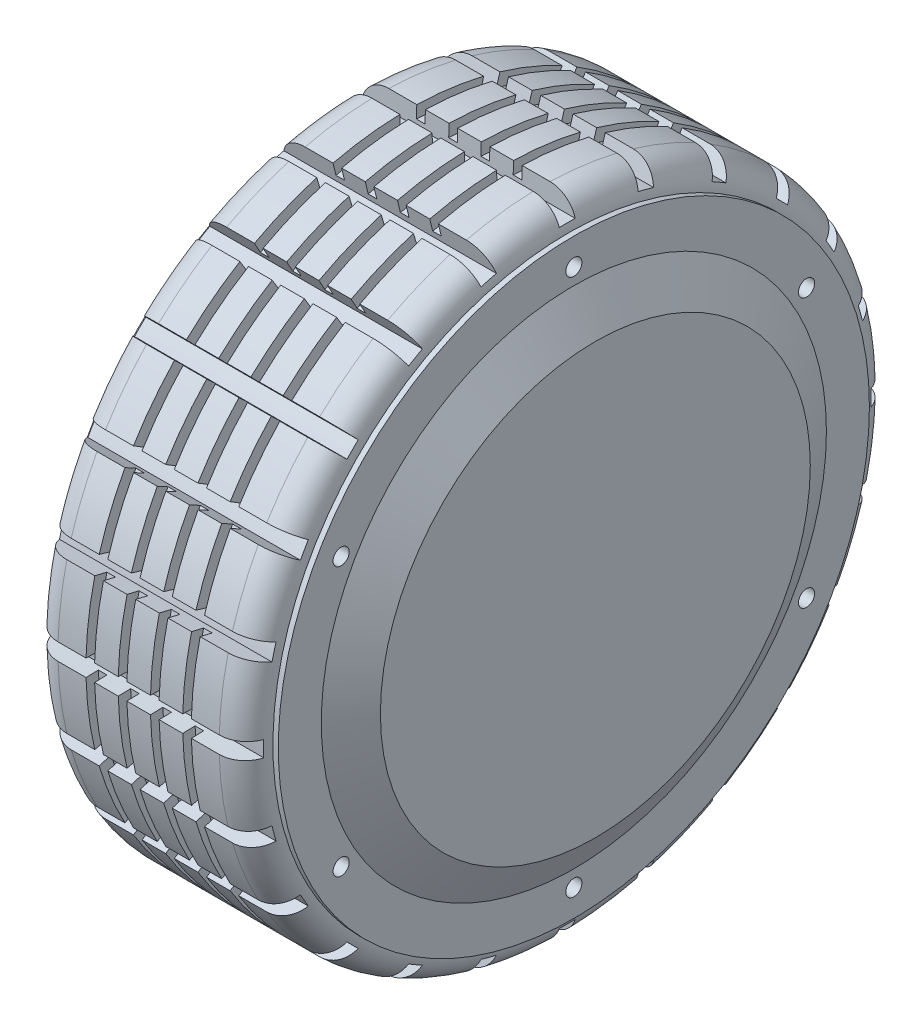
from build123d import *

# Parameters (mm, degrees)
SKETCH_2_W               = 40
SKETCH_2_H               = 60
CUT_EXTRUDE_2_DEPTH      = 1
CUT_EXTRUDE_2_DEPTH_BACK = 1
SKETCH_4_R               = 5
FILLET_1_R               = 5
FILLET_2_R               = 5
SKETCH_9_R               = 1.5
CUT_EXTRUDE_4_DEPTH      = 5
PATTERN_CIRCULAR_1_COUNT = 6
MIRROR_2_COPY_1_SKETCH_R = 1.5
MIRROR_2_COPY_1_DEPTH    = 5
MIRROR_2_COPY_2_SKETCH_R = 1.5
MIRROR_2_COPY_2_DEPTH    = 5
MIRROR_2_COPY_3_SKETCH_R = 1.5
MIRROR_2_COPY_3_DEPTH    = 5
MIRROR_2_COPY_4_SKETCH_R = 1.5
MIRROR_2_COPY_4_DEPTH    = 5
MIRROR_2_COPY_5_SKETCH_R = 1.5
MIRROR_2_COPY_5_DEPTH    = 5
CUT_EXTRUDE_START        = -25
SKETCH_14_R              = 5
CUT_EXTRUDE_7_DEPTH      = 25
PATTERN_LINEAR_1_COUNT   = 4
PATTERN_LINEAR_1_PITCH   = 6
CUT_EXTRUDE_8_REACH      = 119.541
PATTERN_START            = -19.769696007
PATTERN_CIRCULAR_2_DEPTH = 39.539392014


# Read off the part's stored shape, not the designer's step: 阵列(圆周)2
with BuildPart() as part:
    # 草图2 → 旋转1 (revolve)
    with BuildSketch(Plane.XY, mode=Mode.PRIVATE) as revolve_1_sk:
        Rectangle(SKETCH_2_W, SKETCH_2_H)
    revolve(revolve_1_sk.sketch.rotate(Axis((-20, -30, 0), (1, 0, 0)), 90), axis=Axis((-20, -30, 0), (1, 0, 0)))

    # 草图4 → 切除-拉伸2 (cut, two sides: drawn at the far end of the back side and taken through both)
    with BuildSketch(Plane(origin=(20, 0, 0), x_dir=(0, 0, -1), z_dir=(1, 0, 0)).offset(-CUT_EXTRUDE_2_DEPTH_BACK)):
        with Locations(Location((0, -30, 0), (0, 0, 180))):
            Circle(SKETCH_4_R)
    extrude(amount=CUT_EXTRUDE_2_DEPTH + CUT_EXTRUDE_2_DEPTH_BACK, mode=Mode.SUBTRACT)

    # 圆角1
    fillet_1_edges = [part.edges().sort_by_distance(p)[0] for p in [
        (20, -30, -60),
    ]]
    fillet(fillet_1_edges, radius=FILLET_1_R)

    # 圆角2
    fillet_2_edges = [part.edges().sort_by_distance(p)[0] for p in [
        (-20, -30, -60),
    ]]
    fillet(fillet_2_edges, radius=FILLET_2_R)

    # 草图7 → 旋转2 (revolve)
    with BuildSketch(Plane.XY, mode=Mode.PRIVATE) as revolve_2_sk:
        Polygon((-20, -30), (-25, -30), (-25, -70), (-21, -77), (-21, -85), (-20, -85), align=None)
    revolve_2 = revolve(revolve_2_sk.sketch.rotate(Axis((-20, -30, 0), (-1, 0, 0)), 270), axis=Axis((-20, -30, 0), (-1, 0, 0)))

    # 镜向1: 旋转2 across plane
    add(revolve_2.mirror(Plane(origin=(0, 0, 0), x_dir=(0, 0, 1), z_dir=(1, 0, 0))))

    # 草图9 → 切除-拉伸4 (cut)
    with BuildSketch(Plane.ZY.offset(21)):
        with Locations((0, 20)):
            Circle(SKETCH_9_R)
    cut_extrude_4 = extrude(amount=-CUT_EXTRUDE_4_DEPTH, mode=Mode.SUBTRACT)

    # 阵列(圆周)1: 切除-拉伸4 ×6 about axis
    pattern_circular_1_axis = Axis((0, -30, 0), (1, 0, 0))
    for i in range(1, PATTERN_CIRCULAR_1_COUNT):
        add(cut_extrude_4.rotate(pattern_circular_1_axis, i * 360 / PATTERN_CIRCULAR_1_COUNT), mode=Mode.SUBTRACT)

    # 镜向2: 切除-拉伸4 across plane
    add(cut_extrude_4.mirror(Plane(origin=(0, 0, 0), x_dir=(0, 0, 1), z_dir=(1, 0, 0))), mode=Mode.SUBTRACT)

    # 镜向2 copy 1 sketch → 镜向2 copy 1 (cut)
    with BuildSketch(Plane(origin=(21, -15, 25.980762114), x_dir=(0, -0.8660254037844386, 0.5000000000000001), z_dir=(1, 0, 0))):
        with Locations((0, -20)):
            Circle(MIRROR_2_COPY_1_SKETCH_R)
    extrude(amount=-MIRROR_2_COPY_1_DEPTH, mode=Mode.SUBTRACT)

    # 镜向2 copy 2 sketch → 镜向2 copy 2 (cut)
    with BuildSketch(Plane(origin=(21, -45, 25.980762114), x_dir=(0, -0.8660254037844387, -0.4999999999999998), z_dir=(1, 0, 0))):
        with Locations((0, -20)):
            Circle(MIRROR_2_COPY_2_SKETCH_R)
    extrude(amount=-MIRROR_2_COPY_2_DEPTH, mode=Mode.SUBTRACT)

    # 镜向2 copy 3 sketch → 镜向2 copy 3 (cut)
    with BuildSketch(Plane(origin=(21, -60, 0), x_dir=(0, 0, -1), z_dir=(1, 0, 0))):
        with Locations((0, -20)):
            Circle(MIRROR_2_COPY_3_SKETCH_R)
    extrude(amount=-MIRROR_2_COPY_3_DEPTH, mode=Mode.SUBTRACT)

    # 镜向2 copy 4 sketch → 镜向2 copy 4 (cut)
    with BuildSketch(Plane(origin=(21, -45, -25.980762114), x_dir=(0, 0.8660254037844384, -0.5000000000000004), z_dir=(1, 0, 0))):
        with Locations((0, -20)):
            Circle(MIRROR_2_COPY_4_SKETCH_R)
    extrude(amount=-MIRROR_2_COPY_4_DEPTH, mode=Mode.SUBTRACT)

    # 镜向2 copy 5 sketch → 镜向2 copy 5 (cut)
    with BuildSketch(Plane(origin=(21, -15, -25.980762114), x_dir=(0, 0.8660254037844386, 0.5000000000000001), z_dir=(1, 0, 0))):
        with Locations((0, -20)):
            Circle(MIRROR_2_COPY_5_SKETCH_R)
    extrude(amount=-MIRROR_2_COPY_5_DEPTH, mode=Mode.SUBTRACT)

    # 草图14 → 切除-拉伸7 (cut)
    with BuildSketch(Plane.ZY.offset(25).offset(CUT_EXTRUDE_START)):
        with Locations((0, -30)):
            Circle(SKETCH_14_R)
    extrude(amount=CUT_EXTRUDE_7_DEPTH, mode=Mode.SUBTRACT)

    # 草图16 → 切除-旋转1 (revolve, cut)
    with BuildSketch(Plane.XY, mode=Mode.PRIVATE) as cut_revolve_1_sk:
        Polygon((-9.8, 27.7), (-9.8, 30), (-9, 30), (-8.2, 30), (-8.2, 27.7), align=None)
    cut_revolve_1 = revolve(cut_revolve_1_sk.sketch.rotate(Axis((-25, -30, 0), (-1, 0, 0)), 90), axis=Axis((-25, -30, 0), (-1, 0, 0)), mode=Mode.SUBTRACT)

    # 阵列(线性)1: 切除-旋转1 ×4
    with Locations(*[(i * PATTERN_LINEAR_1_PITCH, 0, 0) for i in range(1, PATTERN_LINEAR_1_COUNT)]):
        add(cut_revolve_1, mode=Mode.SUBTRACT)

    # 草图17 → 切除-拉伸8 (cut, up to next)
    with BuildSketch(Plane.ZY.offset(21), mode=Mode.PRIVATE) as cut_extrude_8_sk1:
        with BuildLine():
            Line((1.478997579, 26.480638861), (1.570616898, 29.979439499))
            ThreePointArc((1.570616898, 29.979439499), (0, 30), (-1.570616898, 29.979439499))
            Line((-1.570616898, 29.979439499), (-1.478997579, 26.480638861))
            ThreePointArc((-1.478997579, 26.480638861), (0, 26.5), (1.478997579, 26.480638861))
        make_face()
    cut_extrude_8_tool1 = extrude(cut_extrude_8_sk1.sketch, amount=-CUT_EXTRUDE_8_REACH, mode=Mode.PRIVATE) & part.part
    add(cut_extrude_8_tool1.solids().sort_by_distance((-21, 28.260869, 0))[0], mode=Mode.SUBTRACT)

    # 阵列(圆周)2 outline → 阵列(圆周)2 (cut)
    with BuildSketch(Plane.YZ.offset(PATTERN_START)):
        with BuildLine():
            ThreePointArc((24.17331502, 16.046866976), (24.574809185, 14.623276048), (24.938900502, 13.189663058))
            Line((24.938900502, 13.189663058), (28.342195224, 14.006721831))
            ThreePointArc((28.342195224, 14.006721831), (27.955549578, 15.529142706), (27.529184093, 17.040920682))
            Line((27.529184093, 17.040920682), (24.17331502, 16.046866976))
        make_face()
        with BuildLine():
            Line((21.158409862, 31.349913883), (18.174169286, 29.521168906))
            ThreePointArc((18.174169286, 29.521168906), (18.930435314, 28.25), (19.653166865, 26.959469955))
            Line((19.653166865, 26.959469955), (22.72902676, 28.629525616))
            ThreePointArc((22.72902676, 28.629525616), (21.961524227, 30), (21.158409862, 31.349913883))
        make_face()
        with BuildLine():
            Line((11.301274542, 43.522462261), (8.892033527, 40.983651962))
            ThreePointArc((8.892033527, 40.983651962), (9.951533137, 39.951533137), (10.983651962, 38.892033527))
            Line((10.983651962, 38.892033527), (13.522462261, 41.301274542))
            ThreePointArc((13.522462261, 41.301274542), (12.426406871, 42.426406871), (11.301274542, 43.522462261))
        make_face()
        with BuildLine():
            Line((-1.370474384, 52.72902676), (-3.040530045, 49.653166865))
            ThreePointArc((-3.040530045, 49.653166865), (-1.75, 48.930435314), (-0.478831094, 48.174169286))
            Line((-0.478831094, 48.174169286), (1.349913883, 51.158409861))
            ThreePointArc((1.349913883, 51.158409861), (0, 51.961524227), (-1.370474384, 52.72902676))
        make_face()
        with BuildLine():
            Line((-15.993278169, 58.342195224), (-16.810336942, 54.938900502))
            ThreePointArc((-16.810336942, 54.938900502), (-15.376723952, 54.574809185), (-13.953133024, 54.17331502))
            Line((-13.953133024, 54.17331502), (-12.959079318, 57.529184092))
            ThreePointArc((-12.959079318, 57.529184092), (-14.470857294, 57.955549578), (-15.993278169, 58.342195224))
        make_face()
        with BuildLine():
            Line((-31.570616898, 59.979439499), (-31.478997579, 56.480638861))
            ThreePointArc((-31.478997579, 56.480638861), (-30, 56.5), (-28.521002421, 56.480638861))
            Line((-28.521002421, 56.480638861), (-28.429383102, 59.979439499))
            ThreePointArc((-28.429383102, 59.979439499), (-30, 60), (-31.570616898, 59.979439499))
        make_face()
        with BuildLine():
            Line((-47.040920682, 57.529184092), (-46.046866976, 54.17331502))
            ThreePointArc((-46.046866976, 54.17331502), (-44.623276048, 54.574809185), (-43.189663058, 54.938900502))
            Line((-43.189663058, 54.938900502), (-44.006721831, 58.342195224))
            ThreePointArc((-44.006721831, 58.342195224), (-45.529142706, 57.955549578), (-47.040920682, 57.529184092))
        make_face()
        with BuildLine():
            Line((-61.349913883, 51.158409861), (-59.521168906, 48.174169286))
            ThreePointArc((-59.521168906, 48.174169286), (-58.25, 48.930435314), (-56.959469955, 49.653166865))
            Line((-56.959469955, 49.653166865), (-58.629525616, 52.72902676))
            ThreePointArc((-58.629525616, 52.72902676), (-60, 51.961524227), (-61.349913883, 51.158409861))
        make_face()
        with BuildLine():
            Line((-73.522462261, 41.301274542), (-70.983651962, 38.892033527))
            ThreePointArc((-70.983651962, 38.892033527), (-69.951533137, 39.951533137), (-68.892033527, 40.983651962))
            Line((-68.892033527, 40.983651962), (-71.301274542, 43.522462261))
            ThreePointArc((-71.301274542, 43.522462261), (-72.426406871, 42.426406871), (-73.522462261, 41.301274542))
        make_face()
        with BuildLine():
            Line((-82.72902676, 28.629525616), (-79.653166865, 26.959469955))
            ThreePointArc((-79.653166865, 26.959469955), (-78.930435314, 28.25), (-78.174169286, 29.521168906))
            Line((-78.174169286, 29.521168906), (-81.158409861, 31.349913883))
            ThreePointArc((-81.158409861, 31.349913883), (-81.961524227, 30), (-82.72902676, 28.629525616))
        make_face()
        with BuildLine():
            Line((-88.342195224, 14.006721831), (-84.938900502, 13.189663058))
            ThreePointArc((-84.938900502, 13.189663058), (-84.574809185, 14.623276048), (-84.17331502, 16.046866976))
            Line((-84.17331502, 16.046866976), (-87.529184092, 17.040920682))
            ThreePointArc((-87.529184092, 17.040920682), (-87.955549577, 15.529142706), (-88.342195224, 14.006721831))
        make_face()
        with BuildLine():
            Line((-89.979439499, -1.570616898), (-86.480638861, -1.478997579))
            ThreePointArc((-86.480638861, -1.478997579), (-86.5, 0), (-86.480638861, 1.478997579))
            Line((-86.480638861, 1.478997579), (-89.979439499, 1.570616898))
            ThreePointArc((-89.979439499, 1.570616898), (-90, 0), (-89.979439499, -1.570616898))
        make_face()
        with BuildLine():
            Line((-87.529184092, -17.040920682), (-84.17331502, -16.046866976))
            ThreePointArc((-84.17331502, -16.046866976), (-84.574809185, -14.623276048), (-84.938900502, -13.189663058))
            Line((-84.938900502, -13.189663058), (-88.342195224, -14.006721831))
            ThreePointArc((-88.342195224, -14.006721831), (-87.955549577, -15.529142706), (-87.529184092, -17.040920682))
        make_face()
        with BuildLine():
            Line((-81.158409861, -31.349913883), (-78.174169286, -29.521168906))
            ThreePointArc((-78.174169286, -29.521168906), (-78.930435314, -28.25), (-79.653166865, -26.959469955))
            Line((-79.653166865, -26.959469955), (-82.72902676, -28.629525616))
            ThreePointArc((-82.72902676, -28.629525616), (-81.961524227, -30), (-81.158409861, -31.349913883))
        make_face()
        with BuildLine():
            Line((-71.301274542, -43.522462261), (-68.892033527, -40.983651962))
            ThreePointArc((-68.892033527, -40.983651962), (-69.951533137, -39.951533137), (-70.983651962, -38.892033527))
            Line((-70.983651962, -38.892033527), (-73.522462261, -41.301274542))
            ThreePointArc((-73.522462261, -41.301274542), (-72.426406871, -42.426406871), (-71.301274542, -43.522462261))
        make_face()
        with BuildLine():
            Line((-58.629525616, -52.72902676), (-56.959469955, -49.653166865))
            ThreePointArc((-56.959469955, -49.653166865), (-58.25, -48.930435314), (-59.521168906, -48.174169286))
            Line((-59.521168906, -48.174169286), (-61.349913883, -51.158409861))
            ThreePointArc((-61.349913883, -51.158409861), (-60, -51.961524227), (-58.629525616, -52.72902676))
        make_face()
        with BuildLine():
            Line((-44.006721831, -58.342195224), (-43.189663058, -54.938900502))
            ThreePointArc((-43.189663058, -54.938900502), (-44.623276048, -54.574809185), (-46.046866976, -54.17331502))
            Line((-46.046866976, -54.17331502), (-47.040920682, -57.529184092))
            ThreePointArc((-47.040920682, -57.529184092), (-45.529142706, -57.955549578), (-44.006721831, -58.342195224))
        make_face()
        with BuildLine():
            Line((-28.429383102, -59.979439499), (-28.521002421, -56.480638861))
            ThreePointArc((-28.521002421, -56.480638861), (-30, -56.5), (-31.478997579, -56.480638861))
            Line((-31.478997579, -56.480638861), (-31.570616898, -59.979439499))
            ThreePointArc((-31.570616898, -59.979439499), (-30, -60), (-28.429383102, -59.979439499))
        make_face()
        with BuildLine():
            Line((-12.959079318, -57.529184092), (-13.953133024, -54.17331502))
            ThreePointArc((-13.953133024, -54.17331502), (-15.376723952, -54.574809185), (-16.810336942, -54.938900502))
            Line((-16.810336942, -54.938900502), (-15.993278169, -58.342195224))
            ThreePointArc((-15.993278169, -58.342195224), (-14.470857294, -57.955549578), (-12.959079318, -57.529184092))
        make_face()
        with BuildLine():
            Line((1.349913883, -51.158409861), (-0.478831094, -48.174169286))
            ThreePointArc((-0.478831094, -48.174169286), (-1.75, -48.930435314), (-3.040530045, -49.653166865))
            Line((-3.040530045, -49.653166865), (-1.370474384, -52.72902676))
            ThreePointArc((-1.370474384, -52.72902676), (0, -51.961524227), (1.349913883, -51.158409861))
        make_face()
        with BuildLine():
            Line((13.522462261, -41.301274542), (10.983651962, -38.892033527))
            ThreePointArc((10.983651962, -38.892033527), (9.951533137, -39.951533137), (8.892033527, -40.983651962))
            Line((8.892033527, -40.983651962), (11.301274542, -43.522462261))
            ThreePointArc((11.301274542, -43.522462261), (12.426406871, -42.426406871), (13.522462261, -41.301274542))
        make_face()
        with BuildLine():
            Line((22.72902676, -28.629525616), (19.653166865, -26.959469955))
            ThreePointArc((19.653166865, -26.959469955), (18.930435314, -28.25), (18.174169286, -29.521168906))
            Line((18.174169286, -29.521168906), (21.158409862, -31.349913883))
            ThreePointArc((21.158409862, -31.349913883), (21.961524227, -30), (22.72902676, -28.629525616))
        make_face()
        with BuildLine():
            Line((28.342195224, -14.006721831), (24.938900502, -13.189663058))
            ThreePointArc((24.938900502, -13.189663058), (24.574809185, -14.623276048), (24.17331502, -16.046866976))
            Line((24.17331502, -16.046866976), (27.529184093, -17.040920682))
            ThreePointArc((27.529184093, -17.040920682), (27.955549578, -15.529142706), (28.342195224, -14.006721831))
        make_face()
    extrude(amount=PATTERN_CIRCULAR_2_DEPTH, mode=Mode.SUBTRACT)


solid = part.part
